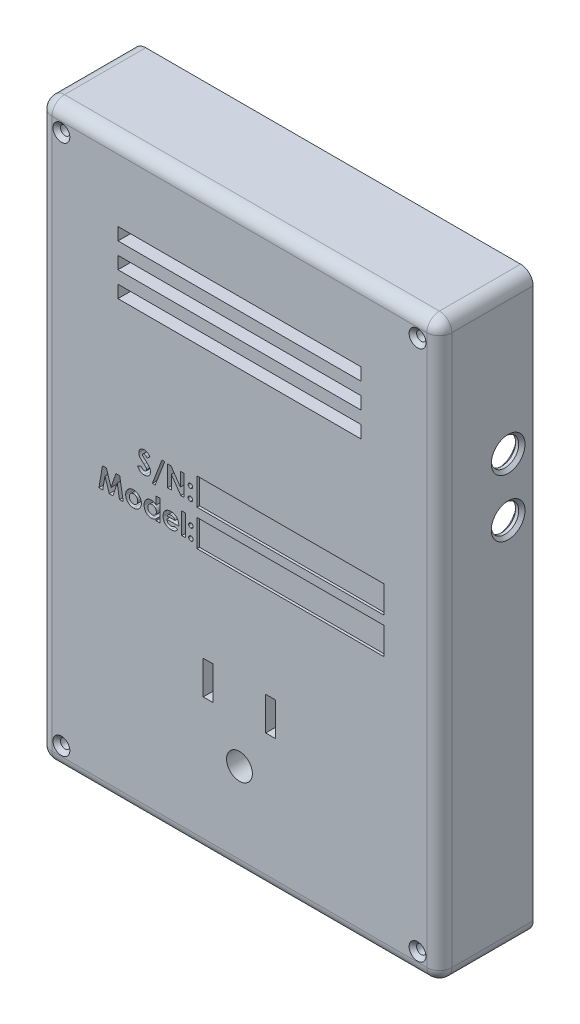
from build123d import *

# Parameters (mm, degrees)
SKETCH5_W                   = 81.28
SKETCH5_H                   = 116.84
CASE_2_DEPTH                = 12.7
CASE_CUT_DEPTH              = 7.366
SKETCH13_R                  = 2.159
BOARD_MOUNT_DEPTH           = 2.54
SKETCH11_R                  = 0.8255
BOARD_MOUNT_SCREW_CUT_DEPTH = 5.588
SKETCH8_R                   = 0.9525
FACEPLATE_SCREW_CUT_DEPTH   = 73.289667311
SKETCH14_R                  = 2.6289
SKETCH14_W                  = 2.032
SKETCH14_H                  = 6.8072
OUTLET_CUT_DEPTH            = 72.545537639
SKETCH24_W                  = 81.28
SKETCH24_H                  = 116.84
BOSS_EXTRUDE1_DEPTH         = 6.35
CUT_EXTRUDE1_START          = -6.35
CUT_EXTRUDE1_DEPTH          = 6.35
FILLET11_R                  = 2.54
FILLET12_R                  = 2.54
FILLET13_R                  = 2.54
SKETCH28_R                  = 0.9525
CUT_EXTRUDE3_DEPTH          = 73.289667311
FILLET14_R                  = 2.54
SKETCH30_W                  = 79.248
SKETCH30_H                  = 114.808
CUT_EXTRUDE4_DEPTH          = 2.032
FILLET15_R                  = 2.54
FILLET16_R                  = 2.54
FILLET17_R                  = 2.54
FILLET18_R                  = 2.54
SKETCH18_R                  = 2.794
CUT_EXTRUDE5_DEPTH          = 2.54
CHAMFER6_SIZE               = 0.635
FILLET19_R                  = 2.54
CHAMFER7_SIZE               = 0.762
SKETCH31_W                  = 38.071387925
SKETCH31_H                  = 5.512590528
SKETCH31_H_2                = 5.504700738
CUT_EXTRUDE6_DEPTH          = 0.508
SKETCH32_W                  = 0.75982906
SKETCH32_H                  = 4.341880342
CUT_EXTRUDE7_DEPTH          = 1.905
SKETCH33_W                  = 49.388401948
SKETCH33_H                  = 2.54
CUT_EXTRUDE8_DEPTH          = 27.94


with BuildPart() as part:
    # Sketch5 → Case 2 (new body)
    with BuildSketch(Plane.XY):
        Rectangle(SKETCH5_W, SKETCH5_H)
    extrude(amount=CASE_2_DEPTH)

    # Sketch4 → Case Cut (cut)
    with BuildSketch(Plane.XY):
        with BuildLine():
            Line((-36.195, 56.515), (36.195, 56.515))
            ThreePointArc((36.195, 56.515), (34.398948776, 52.178948776), (38.735, 53.975))
            Line((38.735, 53.975), (38.735, -53.975))
            ThreePointArc((38.735, -53.975), (34.398948776, -52.178948776), (36.195, -56.515))
            Line((36.195, -56.515), (-36.195, -56.515))
            ThreePointArc((-36.195, -56.515), (-34.398948776, -52.178948776), (-38.735, -53.975))
            Line((-38.735, -53.975), (-38.735, 53.975))
            ThreePointArc((-38.735, 53.975), (-34.398948776, 52.178948776), (-36.195, 56.515))
        make_face()
    extrude(amount=CASE_CUT_DEPTH, mode=Mode.SUBTRACT)

    # Sketch13 → Board Mount (add)
    with BuildSketch(Plane(origin=(0, 0, 7.366), x_dir=(-1, 0, 0), z_dir=(0, 0, -1))):
        with Locations(Location((-35.56, 48.641, 0), (0, 0, 180))):
            Circle(SKETCH13_R)
        with Locations(Location((35.56, 48.641, 0), (0, 0, 180))):
            Circle(SKETCH13_R)
        with Locations(Location((-35.56, -48.641, 0), (0, 0, 180))):
            Circle(SKETCH13_R)
        with Locations(Location((35.56, -48.641, 0), (0, 0, 180))):
            Circle(SKETCH13_R)
    extrude(amount=BOARD_MOUNT_DEPTH)

    # Sketch11 → Board Mount Screw Cut (cut)
    with BuildSketch(Plane(origin=(0, 0, 7.366), x_dir=(-1, 0, 0), z_dir=(0, 0, -1))):
        with Locations((-35.56, 48.641)):
            Circle(SKETCH11_R)
        with Locations((35.56, 48.641)):
            Circle(SKETCH11_R)
        with Locations((35.56, -48.641)):
            Circle(SKETCH11_R)
        with Locations((-35.56, -48.641)):
            Circle(SKETCH11_R)
    extrude(amount=BOARD_MOUNT_SCREW_CUT_DEPTH, mode=Mode.SUBTRACT)

    # Sketch8 → FacePlate Screw Cut (cut, through all)
    with BuildSketch(Plane.XY):
        with Locations((-36.195, 53.975)):
            Circle(SKETCH8_R)
        with Locations((-36.195, -53.975)):
            Circle(SKETCH8_R)
        with Locations((36.195, 53.975)):
            Circle(SKETCH8_R)
        with Locations((36.195, -53.975)):
            Circle(SKETCH8_R)
    extrude(amount=FACEPLATE_SCREW_CUT_DEPTH, mode=Mode.SUBTRACT)

    # Sketch14 → Outlet Cut (cut, through all)
    with BuildSketch(Plane(origin=(0, 0, 7.366), x_dir=(-1, 0, 0), z_dir=(0, 0, -1))):
        with Locations((0, -39.497)):
            Circle(SKETCH14_R)
        with Locations((-6.35, -27.559)):
            Rectangle(SKETCH14_W, SKETCH14_H)
        with Locations((6.35, -27.559)):
            Rectangle(SKETCH14_W, SKETCH14_H)
    extrude(amount=-OUTLET_CUT_DEPTH, mode=Mode.SUBTRACT)

    # Sketch24 → Boss-Extrude1 (add)
    with BuildSketch(Plane.XY):
        Rectangle(SKETCH24_W, SKETCH24_H)
    extrude(amount=-BOSS_EXTRUDE1_DEPTH)

    # Sketch26 → Cut-Extrude1 (cut)
    with BuildSketch(Plane.XY.offset(CUT_EXTRUDE1_START)):
        with BuildLine():
            Line((-36.195, 56.515), (36.195, 56.515))
            ThreePointArc((36.195, 56.515), (34.398948776, 52.178948776), (38.735, 53.975))
            Line((38.735, 53.975), (38.735, -53.975))
            ThreePointArc((38.735, -53.975), (34.398948776, -52.178948776), (36.195, -56.515))
            Line((36.195, -56.515), (-36.195, -56.515))
            ThreePointArc((-36.195, -56.515), (-34.398948776, -52.178948776), (-38.735, -53.975))
            Line((-38.735, -53.975), (-38.735, 53.975))
            ThreePointArc((-38.735, 53.975), (-34.398948776, 52.178948776), (-36.195, 56.515))
        make_face()
    extrude(amount=CUT_EXTRUDE1_DEPTH, mode=Mode.SUBTRACT)

    # Fillet11
    fillet11_edges = [part.edges().sort_by_distance(p)[0] for p in [
        (40.64, -58.42, 3.175),
    ]]
    fillet(fillet11_edges, radius=FILLET11_R)

    # Fillet12
    fillet12_edges = [part.edges().sort_by_distance(p)[0] for p in [
        (40.64, 58.42, 3.175),
    ]]
    fillet(fillet12_edges, radius=FILLET12_R)

    # Fillet13
    fillet13_edges = [part.edges().sort_by_distance(p)[0] for p in [
        (-40.64, 58.42, 3.175),
    ]]
    fillet(fillet13_edges, radius=FILLET13_R)

    # Sketch28 → Cut-Extrude3 (cut, through all)
    with BuildSketch(Plane(origin=(0, 0, 0), x_dir=(-1, 0, 0), z_dir=(0, 0, -1))):
        with Locations((-36.195, 53.975)):
            Circle(SKETCH28_R)
        with Locations((-36.195, -53.975)):
            Circle(SKETCH28_R)
        with Locations((36.195, 53.975)):
            Circle(SKETCH28_R)
        with Locations((36.195, -53.975)):
            Circle(SKETCH28_R)
    extrude(amount=CUT_EXTRUDE3_DEPTH, mode=Mode.SUBTRACT)

    # Fillet14
    fillet14_edges = [part.edges().sort_by_distance(p)[0] for p in [
        (-40.64, -58.42, 3.175),
    ]]
    fillet(fillet14_edges, radius=FILLET14_R)

    # Sketch30 → Cut-Extrude4 (cut)
    with BuildSketch(Plane(origin=(0, 0, -6.35), x_dir=(-1, 0, 0), z_dir=(0, 0, -1))):
        Rectangle(SKETCH30_W, SKETCH30_H)
    extrude(amount=-CUT_EXTRUDE4_DEPTH, mode=Mode.SUBTRACT)

    # Fillet15
    fillet15_edges = [part.edges().sort_by_distance(p)[0] for p in [
        (39.624, 57.404, -5.334),
    ]]
    fillet(fillet15_edges, radius=FILLET15_R)

    # Fillet16
    fillet16_edges = [part.edges().sort_by_distance(p)[0] for p in [
        (-39.624, 57.404, -5.334),
    ]]
    fillet(fillet16_edges, radius=FILLET16_R)

    # Fillet17
    fillet17_edges = [part.edges().sort_by_distance(p)[0] for p in [
        (-39.624, -57.404, -5.334),
    ]]
    fillet(fillet17_edges, radius=FILLET17_R)

    # Fillet18
    fillet18_edges = [part.edges().sort_by_distance(p)[0] for p in [
        (39.624, -57.404, -5.334),
    ]]
    fillet(fillet18_edges, radius=FILLET18_R)

    # Sketch18 → Cut-Extrude5 (cut)
    with BuildSketch(Plane(origin=(40.64, 0, 0), x_dir=(0, 0, -1), z_dir=(1, 0, 0))):
        with Locations((1.27, 28.829)):
            Circle(SKETCH18_R)
        with Locations((1.27, 17.145)):
            Circle(SKETCH18_R)
    extrude(amount=-CUT_EXTRUDE5_DEPTH, mode=Mode.SUBTRACT)

    # Chamfer6
    # the kernel refuses this chamfer: 0.635 mm, written as the material it takes off along each edge
    with BuildSketch(Plane(origin=(38.735, 28.829, -1.27), x_dir=(0, 0, -1), z_dir=(0, -1, 0))) as chamfer6_piece_1:
        Polygon((2.794, CHAMFER6_SIZE), (2.794 + CHAMFER6_SIZE, 0), (2.794, 0), align=None)
    revolve(axis=Axis((38.735, 28.829, -1.27), (1, 0, 0)), mode=Mode.SUBTRACT)
    with BuildSketch(Plane(origin=(40.64, 28.829, -1.27), x_dir=(0, 0, -1), z_dir=(0, -1, 0))) as chamfer6_piece_2:
        Polygon((2.794 + CHAMFER6_SIZE, 0), (2.794, -CHAMFER6_SIZE), (2.794, 0), align=None)
    revolve(axis=Axis((40.64, 28.829, -1.27), (1, 0, 0)), mode=Mode.SUBTRACT)
    with BuildSketch(Plane(origin=(38.735, 17.145, -1.27), x_dir=(0, 0, -1), z_dir=(0, -1, 0))) as chamfer6_piece_3:
        Polygon((2.794, CHAMFER6_SIZE), (2.794 + CHAMFER6_SIZE, 0), (2.794, 0), align=None)
    revolve(axis=Axis((38.735, 17.145, -1.27), (1, 0, 0)), mode=Mode.SUBTRACT)
    with BuildSketch(Plane(origin=(40.64, 17.145, -1.27), x_dir=(0, 0, -1), z_dir=(0, -1, 0))) as chamfer6_piece_4:
        Polygon((2.794 + CHAMFER6_SIZE, 0), (2.794, -CHAMFER6_SIZE), (2.794, 0), align=None)
    revolve(axis=Axis((40.64, 17.145, -1.27), (1, 0, 0)), mode=Mode.SUBTRACT)

    # Fillet19
    fillet19_edges = [part.edges().sort_by_distance(p)[0] for p in [
        (40.64, 0, 12.7),
        (39.896051224, -57.676051224, 12.7),
        (0, 58.42, 12.7),
        (39.896051224, 57.676051224, 12.7),
        (-40.64, 0, 12.7),
        (-39.896051224, 57.676051224, 12.7),
        (0, -58.42, 12.7),
        (-39.896051224, -57.676051224, 12.7),
    ]]
    fillet(fillet19_edges, radius=FILLET19_R)

    # Chamfer7
    chamfer7_edges = [part.edges().sort_by_distance(p)[0] for p in [
        (-37.1475, 53.975, 12.7),
        (-37.1475, -53.975, 12.7),
        (35.2425, 53.975, 12.7),
        (35.2425, -53.975, 12.7),
    ]]
    chamfer(chamfer7_edges, length=CHAMFER7_SIZE)

    # Sketch31 → Cut-Extrude6 (cut)
    with BuildSketch(Plane.XY.offset(12.7)):
        with Locations((10.393000027, 4.552836284)):
            Rectangle(SKETCH31_W, SKETCH31_H)
        with Locations((10.393000027, -2.752350369)):
            Rectangle(SKETCH31_W, SKETCH31_H_2)
    extrude(amount=-CUT_EXTRUDE6_DEPTH, mode=Mode.SUBTRACT)

    # Sketch32 → Cut-Extrude7 (cut)
    # profile 1 of 12: a face of its own
    with BuildSketch(Plane.XY.offset(12.7)):
        with BuildLine():
            Line((-18.191123097, 5.877144928), (-18.759298845, 5.35730652))
            add(Edge.make_bspline(
                [(-18.759298845, 5.35730652), (-18.783637058, 5.3916381), (-18.830363032, 5.457549944), (-18.906100963, 5.545807458), (-18.981496898, 5.621097685), (-19.057249335, 5.683106097), (-19.134029715, 5.731455949), (-19.211704758, 5.765688177), (-19.289834103, 5.78744993), (-19.342324962, 5.790159792), (-19.368179721, 5.791494554)],
                knots=[0, 0, 0, 0, 1.299362458, 2.494594718, 3.587462134, 4.587049575, 5.512617175, 6.380583204, 7.202344345, 8, 8, 8, 8], degree=3))
            add(Edge.make_bspline(
                [(-19.368179721, 5.791494554), (-19.392296298, 5.790648788), (-19.438859073, 5.789015835), (-19.505237763, 5.772784401), (-19.564169709, 5.744771331), (-19.615597397, 5.708141885), (-19.656335713, 5.664011895), (-19.688862099, 5.617730882), (-19.707177188, 5.56664711), (-19.709587814, 5.531560715), (-19.710781217, 5.514190869)],
                knots=[0, 0, 0, 0, 1.185010067, 2.2879431, 3.333075148, 4.379039566, 5.372662701, 6.27520591, 7.14612461, 8, 8, 8, 8], degree=3))
            add(Edge.make_bspline(
                [(-19.710781217, 5.514190869), (-19.710033372, 5.496570541), (-19.708527316, 5.461085649), (-19.693980864, 5.409078121), (-19.672055208, 5.358260713), (-19.651104348, 5.327325738), (-19.640395266, 5.311513251)],
                knots=[0, 0, 0, 0, 0.967525499, 1.948461899, 2.951351359, 4, 4, 4, 4], degree=3))
            add(Edge.make_bspline(
                [(-19.640395266, 5.311513251), (-19.630659552, 5.29922237), (-19.608249223, 5.270930386), (-19.565517316, 5.226120294), (-19.511855016, 5.171224009), (-19.445197284, 5.108129253), (-19.368311265, 5.034566892), (-19.277633194, 4.95342869), (-19.175773181, 4.862201892), (-19.103373444, 4.798674854), (-19.06543533, 4.765386114)],
                knots=[0, 0, 0, 0, 0.473873513, 1.090794244, 1.870441696, 2.795289791, 3.865433203, 5.087734844, 6.473946851, 8, 8, 8, 8], degree=3))
            add(Edge.make_bspline(
                [(-19.06543533, 4.765386114), (-19.029824953, 4.734567129), (-18.962243855, 4.676079098), (-18.866089373, 4.593064728), (-18.781585599, 4.518378724), (-18.707501503, 4.453141963), (-18.64496013, 4.396669961), (-18.593698554, 4.348692783), (-18.553090703, 4.310144456), (-18.530007518, 4.286861243), (-18.520156217, 4.276924576)],
                knots=[0, 0, 0, 0, 1.543621617, 2.929473131, 4.163658386, 5.240097082, 6.164993805, 6.925417477, 7.541396219, 8, 8, 8, 8], degree=3))
            add(Edge.make_bspline(
                [(-18.520156217, 4.276924576), (-18.482782434, 4.236478138), (-18.410936897, 4.158725881), (-18.317563027, 4.038234335), (-18.240713312, 3.920610017), (-18.181260915, 3.803639635), (-18.136360074, 3.685635539), (-18.104704386, 3.563703686), (-18.085745583, 3.436569964), (-18.083640714, 3.349816718), (-18.082576089, 3.305937663)],
                knots=[0, 0, 0, 0, 1.206664779, 2.319633467, 3.337109185, 4.282041471, 5.190008762, 6.099243693, 7.03861361, 8, 8, 8, 8], degree=3))
            add(Edge.make_bspline(
                [(-18.082576089, 3.305937663), (-18.083333861, 3.263182906), (-18.08482064, 3.179296481), (-18.103030829, 3.056541193), (-18.128997489, 2.939059055), (-18.1691465, 2.828128438), (-18.218079878, 2.721928451), (-18.279424934, 2.622113351), (-18.351466291, 2.527672968), (-18.434036748, 2.440295541), (-18.525369477, 2.361006582), (-18.62333251, 2.290421678), (-18.728883778, 2.232144849), (-18.841121467, 2.184158037), (-18.959985499, 2.147197952), (-19.085334271, 2.119881006), (-19.217359513, 2.103485805), (-19.307640277, 2.101771881), (-19.353763321, 2.100896264)],
                knots=[0, 0, 0, 0, 1.043214005, 2.046824704, 3.02475056, 3.976699089, 4.921714032, 5.875962561, 6.831408892, 7.817874052, 8.806269674, 9.781291748, 10.760897367, 11.74438705, 12.757449933, 13.795994037, 14.874007457, 16, 16, 16, 16], degree=3))
            add(Edge.make_bspline(
                [(-19.353763321, 2.100896264), (-19.389969519, 2.101538586), (-19.461678554, 2.102810752), (-19.567366831, 2.113196929), (-19.66942081, 2.129959113), (-19.767725536, 2.153984331), (-19.862723889, 2.184427541), (-19.954419771, 2.221612755), (-20.042180175, 2.266116331), (-20.126669137, 2.317023097), (-20.207475937, 2.376132559), (-20.285622345, 2.442236243), (-20.360332136, 2.516350852), (-20.431964128, 2.598301108), (-20.500059997, 2.688319076), (-20.566848767, 2.785151087), (-20.629362144, 2.890594214), (-20.667979437, 2.96456342), (-20.687704294, 3.002345249)],
                knots=[0, 0, 0, 0, 1.016823716, 2.013894106, 2.979844003, 3.91962641, 4.853723003, 5.779685073, 6.695824784, 7.614987388, 8.547259901, 9.504950863, 10.487499108, 11.500346958, 12.559593716, 13.656357062, 14.802919212, 16, 16, 16, 16], degree=3))
            Line((-20.687704294, 3.002345249), (-20.019461772, 3.403460366))
            add(Edge.make_bspline(
                [(-20.019461772, 3.403460366), (-19.994788925, 3.360573054), (-19.947488968, 3.278354412), (-19.86733477, 3.167883246), (-19.785220886, 3.073282978), (-19.699248916, 2.996225674), (-19.610464248, 2.93568098), (-19.518438031, 2.892411542), (-19.423105609, 2.865627808), (-19.358169495, 2.862356896), (-19.325778546, 2.860725324)],
                knots=[0, 0, 0, 0, 1.283663364, 2.460892379, 3.537111102, 4.529833553, 5.449777664, 6.316464042, 7.160231139, 8, 8, 8, 8], degree=3))
            add(Edge.make_bspline(
                [(-19.325778546, 2.860725324), (-19.292832314, 2.862057754), (-19.228911825, 2.864642863), (-19.137673506, 2.888520734), (-19.054022761, 2.926010744), (-18.981715675, 2.979503818), (-18.920490593, 3.041242955), (-18.875302969, 3.109930569), (-18.846915798, 3.184248909), (-18.843914586, 3.235875316), (-18.842405148, 3.261840441)],
                knots=[0, 0, 0, 0, 1.13588714, 2.203786484, 3.234766741, 4.283437687, 5.291419208, 6.222934724, 7.106237994, 8, 8, 8, 8], degree=3))
            add(Edge.make_bspline(
                [(-18.842405148, 3.261840441), (-18.843799052, 3.285996764), (-18.846630635, 3.335068022), (-18.867487199, 3.408029092), (-18.90009237, 3.480956981), (-18.938666586, 3.540774409), (-18.977920682, 3.590857919), (-19.015456451, 3.634253015), (-19.061165088, 3.682197), (-19.114930696, 3.734750182), (-19.176042892, 3.792375201), (-19.244553154, 3.855066414), (-19.321245998, 3.922271587), (-19.375452651, 3.968051086), (-19.403796708, 3.991988678)],
                knots=[0, 0, 0, 0, 0.916159276, 1.861089862, 2.860218735, 3.940849679, 4.552606315, 5.27541173, 6.11797699, 7.06649574, 8.129236253, 9.306560635, 10.591630461, 12, 12, 12, 12], degree=3))
            add(Edge.make_bspline(
                [(-19.403796708, 3.991988678), (-19.457679889, 4.037579016), (-19.561098022, 4.125080674), (-19.707240965, 4.254317867), (-19.838928842, 4.375101866), (-19.955024255, 4.488925826), (-20.057006439, 4.59368768), (-20.144184727, 4.690238346), (-20.215601426, 4.779322579), (-20.290752102, 4.884836891), (-20.362160269, 5.013413331), (-20.42387719, 5.168105694), (-20.463916523, 5.322778428), (-20.468402374, 5.426617183), (-20.470610277, 5.477725858)],
                knots=[0, 0, 0, 0, 1.345494975, 2.582412109, 3.71882943, 4.751509156, 5.681369928, 6.505683931, 7.230279997, 7.856715994, 8.973648664, 10.023341002, 11.027102913, 12, 12, 12, 12], degree=3))
            add(Edge.make_bspline(
                [(-20.470610277, 5.477725858), (-20.469692013, 5.513969387), (-20.467882934, 5.585373032), (-20.451745677, 5.690361689), (-20.42762793, 5.791666921), (-20.392602038, 5.888919121), (-20.347142659, 5.981996477), (-20.29193401, 6.071354641), (-20.226118803, 6.156171181), (-20.151949509, 6.236389869), (-20.070233936, 6.309700622), (-19.982910462, 6.374404707), (-19.890473345, 6.429054718), (-19.793488069, 6.47439087), (-19.691353656, 6.509092815), (-19.584822526, 6.533691283), (-19.47374188, 6.548321668), (-19.398187222, 6.550310499), (-19.359699486, 6.551323614)],
                knots=[0, 0, 0, 0, 1.010766082, 1.991317756, 2.957454644, 3.913069143, 4.869106762, 5.843196583, 6.838735724, 7.860187025, 8.887984031, 9.89767229, 10.887916223, 11.879572884, 12.879850636, 13.892031539, 14.926195476, 16, 16, 16, 16], degree=3))
            add(Edge.make_bspline(
                [(-19.359699486, 6.551323614), (-19.309821285, 6.549498963), (-19.210458604, 6.545864065), (-19.063548015, 6.517440346), (-18.920051894, 6.472741054), (-18.80442003, 6.418816276), (-18.712413914, 6.366579318), (-18.641899821, 6.318486107), (-18.570147936, 6.263392749), (-18.496579624, 6.201125631), (-18.422561899, 6.130511557), (-18.345990082, 6.053231552), (-18.267907559, 5.968617736), (-18.217166299, 5.908170018), (-18.191123097, 5.877144928)],
                knots=[0, 0, 0, 0, 1.282922637, 2.555718331, 3.837320111, 5.142675274, 5.830281639, 6.55870424, 7.337177975, 8.157850921, 9.037902056, 9.96903443, 10.957596896, 12, 12, 12, 12], degree=3))
        make_face()
    # profile 2 of 12: a face of its own
    with BuildSketch(Plane.XY.offset(12.7)):
        Polygon((-17.702661559, 1.449614213), (-15.754751569, 6.551323614), (-15.17894361, 6.551323614), (-17.126853599, 1.449614213), align=None)
    # profile 3 of 12: a face of its own
    with BuildSketch(Plane.XY.offset(12.7)):
        Polygon((-14.609071815, 6.442776606), (-13.924716847, 6.442776606), (-12.00394361, 3.657019394), (-12.00394361, 6.442776606), (-11.24411455, 6.442776606), (-11.24411455, 2.209443272), (-11.933557659, 2.209443272), (-13.849242755, 4.986720249), (-13.849242755, 2.209443272), (-14.609071815, 2.209443272), align=None)
    # profile 4 of 12: a face of its own
    with BuildSketch(Plane.XY.offset(12.7)):
        with BuildLine():
            add(Edge.make_bspline(
                [(-9.9686872, 5.35730652), (-9.937984768, 5.355718732), (-9.87745762, 5.352588546), (-9.790545469, 5.326478209), (-9.711335748, 5.282486162), (-9.641172065, 5.223512547), (-9.581903266, 5.153199943), (-9.538407615, 5.073439373), (-9.511958455, 4.986110206), (-9.508913781, 4.925280522), (-9.507362413, 4.894285687)],
                knots=[0, 0, 0, 0, 1.013817282, 1.998651736, 2.969187861, 3.991244904, 5.013301947, 5.9920405, 6.976874954, 8, 8, 8, 8], degree=3))
            add(Edge.make_bspline(
                [(-9.507362413, 4.894285687), (-9.508893514, 4.863843269), (-9.511898432, 4.804097377), (-9.538799386, 4.718083569), (-9.581866264, 4.638752833), (-9.641182178, 4.568453843), (-9.711333192, 4.509476568), (-9.790546146, 4.465485454), (-9.877457444, 4.439374871), (-9.937984709, 4.436244719), (-9.9686872, 4.434656948)],
                knots=[0, 0, 0, 0, 1.009116963, 1.980479832, 2.963706907, 3.990451133, 5.017195359, 5.992182391, 6.981533323, 8, 8, 8, 8], degree=3))
            add(Edge.make_bspline(
                [(-9.9686872, 4.434656948), (-9.99940554, 4.436214655), (-10.059964051, 4.43928554), (-10.146757405, 4.465862547), (-10.226762822, 4.508213247), (-10.296884149, 4.566824871), (-10.356742443, 4.636055979), (-10.398546924, 4.716040624), (-10.425601169, 4.802663802), (-10.428518728, 4.863267593), (-10.430011986, 4.894285687)],
                knots=[0, 0, 0, 0, 1.016706445, 2.004347467, 2.981433789, 4.000427929, 5.018214116, 5.995300439, 6.973959266, 8, 8, 8, 8], degree=3))
            add(Edge.make_bspline(
                [(-10.430011986, 4.894285687), (-10.428481289, 4.92529182), (-10.425477182, 4.986143677), (-10.398772747, 5.073182383), (-10.35649654, 5.15345188), (-10.296961165, 5.223440376), (-10.226780242, 5.282779937), (-10.146985625, 5.326258075), (-10.059938403, 5.352626918), (-9.999396909, 5.355731645), (-9.9686872, 5.35730652)],
                knots=[0, 0, 0, 0, 1.022642663, 2.007012786, 2.980863166, 4.002438329, 5.024013493, 6.00229059, 6.986660713, 8, 8, 8, 8], degree=3))
        make_face()
    # profile 5 of 12: a face of its own
    with BuildSketch(Plane.XY.offset(12.7)):
        with BuildLine():
            add(Edge.make_bspline(
                [(-9.9686872, 3.077819341), (-9.938013801, 3.076137592), (-9.877623178, 3.072826519), (-9.790366961, 3.048116329), (-9.711617723, 3.003720953), (-9.641205382, 2.945814879), (-9.581666479, 2.87614614), (-9.538633107, 2.796697462), (-9.511835147, 2.709777455), (-9.508876633, 2.649196835), (-9.507362413, 2.618190601)],
                knots=[0, 0, 0, 0, 1.016957001, 2.002212695, 2.9757545, 3.99499976, 5.013036768, 5.994806404, 6.97370641, 8, 8, 8, 8], degree=3))
            add(Edge.make_bspline(
                [(-9.507362413, 2.618190601), (-9.508866713, 2.587179388), (-9.511805846, 2.526589038), (-9.538818546, 2.439499662), (-9.581602174, 2.359397988), (-9.641210159, 2.288982703), (-9.711326121, 2.229985335), (-9.790548019, 2.185999349), (-9.877456956, 2.159887412), (-9.937984545, 2.156757446), (-9.9686872, 2.155169768)],
                knots=[0, 0, 0, 0, 1.023218912, 1.999186227, 2.986238111, 4.008388923, 5.030539734, 6.0011649, 6.986089706, 8, 8, 8, 8], degree=3))
            add(Edge.make_bspline(
                [(-9.9686872, 2.155169768), (-9.99939713, 2.156744535), (-10.05993906, 2.15984905), (-10.146983091, 2.186219446), (-10.226789867, 2.229691667), (-10.296923446, 2.289054267), (-10.356797733, 2.359148641), (-10.398364982, 2.439752397), (-10.425629298, 2.526556205), (-10.428528251, 2.587168272), (-10.430011986, 2.618190601)],
                knots=[0, 0, 0, 0, 1.013427518, 1.99788335, 2.976245624, 3.997909735, 5.019573847, 6.001765691, 6.977268297, 8, 8, 8, 8], degree=3))
            add(Edge.make_bspline(
                [(-10.430011986, 2.618190601), (-10.428518462, 2.649208145), (-10.425600384, 2.70981086), (-10.398549893, 2.796441816), (-10.356731114, 2.876396841), (-10.296928439, 2.945743166), (-10.226496763, 3.004012328), (-10.147165165, 3.047899247), (-10.059772922, 3.072865165), (-9.999367907, 3.076150609), (-9.9686872, 3.077819341)],
                knots=[0, 0, 0, 0, 1.025808215, 2.00424526, 2.981110158, 3.998665696, 5.017428914, 5.998734231, 6.983523959, 8, 8, 8, 8], degree=3))
        make_face()
    # profile 6 of 12: a face of its own
    with BuildSketch(Plane.XY.offset(12.7)):
        Polygon((-27.846040786, -0.50739833), (-27.057378927, -0.50739833), (-26.091480156, -3.460216172), (-25.118797197, -0.50739833), (-24.337767549, -0.50739833), (-23.622035711, -4.740731663), (-24.39119303, -4.740731663), (-24.843189558, -2.066913554), (-25.723437955, -4.740731663), (-26.464610498, -4.740731663), (-27.339770754, -2.066913554), (-27.790919258, -4.740731663), (-28.5609246, -4.740731663), align=None)
    # profile 7 of 12: a face of its own
    with BuildSketch(Plane.XY.offset(12.7)):
        with BuildLine():
            add(Edge.make_bspline(
                [(-21.551162314, -1.592868415), (-21.515239063, -1.593507694), (-21.444094748, -1.594773756), (-21.338134179, -1.605312564), (-21.234026045, -1.622507064), (-21.131171946, -1.64477094), (-21.030526979, -1.67596596), (-20.931563274, -1.713379563), (-20.833395968, -1.756334754), (-20.738461555, -1.807466457), (-20.646074204, -1.862923452), (-20.558485498, -1.924097067), (-20.476422799, -1.990506806), (-20.398362745, -2.060612905), (-20.32794306, -2.137467555), (-20.260663549, -2.217367578), (-20.200159159, -2.303175512), (-20.14414081, -2.392800416), (-20.094268076, -2.485724008), (-20.050962779, -2.581299876), (-20.013377853, -2.678206618), (-19.983949609, -2.777624624), (-19.959585736, -2.878242935), (-19.9442104, -2.981294553), (-19.933279602, -3.085720881), (-19.932053913, -3.156029277), (-19.931437421, -3.191392721)],
                knots=[0, 0, 0, 0, 1.022364134, 2.024744242, 3.027414945, 4.024939316, 5.017584196, 6.023349371, 7.035562955, 8.064994934, 9.090267829, 10.101425541, 11.102933353, 12.093946398, 13.084502048, 14.067315274, 15.065326281, 16.070028806, 17.074376865, 18.064572984, 19.055292013, 20.030201733, 21.013838017, 21.999348303, 22.993720005, 24, 24, 24, 24], degree=3))
            add(Edge.make_bspline(
                [(-19.931437421, -3.191392721), (-19.932088026, -3.227032441), (-19.933381577, -3.297892285), (-19.943814937, -3.40330087), (-19.961075252, -3.506837093), (-19.983424577, -3.609110901), (-20.014502857, -3.708813605), (-20.050814509, -3.80741486), (-20.095388491, -3.903570696), (-20.144668312, -3.998330081), (-20.201046836, -4.088904537), (-20.261498852, -4.175572059), (-20.328496564, -4.256058952), (-20.39835252, -4.332861338), (-20.474380145, -4.403382103), (-20.555365899, -4.468766318), (-20.640608667, -4.529813333), (-20.730721437, -4.585090871), (-20.824550014, -4.633661272), (-20.920511996, -4.677451452), (-21.019168516, -4.713909903), (-21.120315399, -4.743640767), (-21.224013986, -4.76666063), (-21.33003534, -4.782298297), (-21.438151127, -4.793174114), (-21.510995288, -4.794390887), (-21.54777022, -4.795005167)],
                knots=[0, 0, 0, 0, 1.012026251, 2.012137606, 3.004615893, 3.992048833, 4.982446996, 5.968083444, 6.973977695, 7.990229942, 8.999482246, 10.001782172, 10.988562221, 11.971415814, 12.948383116, 13.930088534, 14.925840678, 15.924049238, 16.929462851, 17.924729459, 18.917889337, 19.913673841, 20.916777188, 21.931792057, 22.95587778, 24, 24, 24, 24], degree=3))
            add(Edge.make_bspline(
                [(-21.54777022, -4.795005167), (-21.60154267, -4.79342684), (-21.707528987, -4.790315933), (-21.863621774, -4.769007031), (-22.013575415, -4.732328824), (-22.157634258, -4.681200213), (-22.295985439, -4.615680802), (-22.427421539, -4.534590582), (-22.553249989, -4.439525987), (-22.671291347, -4.331290511), (-22.779433221, -4.212546392), (-22.873908159, -4.085787768), (-22.954125027, -3.952914539), (-23.020011653, -3.813775184), (-23.070862693, -3.668178905), (-23.107585821, -3.516560985), (-23.128920775, -3.358495247), (-23.132005371, -3.251100824), (-23.133574173, -3.196480862)],
                knots=[0, 0, 0, 0, 1.029999031, 2.030143771, 3.011211297, 3.982305373, 4.953580601, 5.938004764, 6.935448627, 7.970290061, 9.001484052, 10.007591832, 10.993831261, 11.969999897, 12.951306496, 13.942897864, 14.953773953, 16, 16, 16, 16], degree=3))
            add(Edge.make_bspline(
                [(-23.133574173, -3.196480862), (-23.131950663, -3.138158715), (-23.128759685, -3.023527704), (-23.103421921, -2.855590659), (-23.062960246, -2.694798898), (-23.00488006, -2.541602206), (-22.93068773, -2.395718032), (-22.840115709, -2.257454062), (-22.732716386, -2.126778977), (-22.65047001, -2.047742206), (-22.608647624, -2.007551909)],
                knots=[0, 0, 0, 0, 1.043912699, 2.05178951, 3.033892, 4.007821512, 4.978932272, 5.95884105, 6.962068106, 8, 8, 8, 8], degree=3))
            add(Edge.make_bspline(
                [(-22.608647624, -2.007551909), (-22.570271405, -1.974238673), (-22.494563068, -1.908518555), (-22.371561939, -1.825163359), (-22.245622662, -1.753169901), (-22.115235801, -1.693977887), (-21.980037872, -1.649348064), (-21.840721686, -1.616861546), (-21.697316213, -1.596907375), (-21.600127859, -1.594221577), (-21.551162314, -1.592868415)],
                knots=[0, 0, 0, 0, 1.048115528, 2.067714963, 3.060638214, 4.039924844, 5.017819947, 5.994373833, 6.98952318, 8, 8, 8, 8], degree=3))
        make_face()
        with BuildLine():
            add(Edge.make_bspline(
                [(-21.534201844, -2.298423971), (-21.56362034, -2.299401744), (-21.621530966, -2.301326502), (-21.706776929, -2.311656161), (-21.787403459, -2.332827684), (-21.865011949, -2.359752067), (-21.938229496, -2.395759635), (-22.009061269, -2.437896789), (-22.073824171, -2.490626251), (-22.135652287, -2.548466613), (-22.191778434, -2.612696784), (-22.239603241, -2.682675506), (-22.282335766, -2.755725542), (-22.314737673, -2.834521343), (-22.341553348, -2.916909192), (-22.359701875, -3.004220226), (-22.372331983, -3.095479133), (-22.373269589, -3.157992109), (-22.373745113, -3.189696674)],
                knots=[0, 0, 0, 0, 1.030650113, 2.02884584, 2.99876339, 3.944280128, 4.900564847, 5.851248946, 6.823638398, 7.81794922, 8.81432732, 9.802856497, 10.78262424, 11.771747962, 12.779760563, 13.812642396, 14.89064281, 16, 16, 16, 16], degree=3))
            add(Edge.make_bspline(
                [(-22.373745113, -3.189696674), (-22.373188686, -3.222519301), (-22.372101255, -3.286664822), (-22.360840683, -3.380325909), (-22.342271628, -3.46920966), (-22.31589082, -3.553178768), (-22.2827125, -3.632835954), (-22.242006549, -3.707734287), (-22.193343361, -3.777423431), (-22.138171117, -3.841817571), (-22.077759866, -3.900268844), (-22.011565941, -3.95042954), (-21.942361292, -3.994012527), (-21.868551071, -4.029016392), (-21.791183592, -4.056042216), (-21.710029185, -4.075940422), (-21.624661383, -4.08666061), (-21.566454033, -4.088507161), (-21.536745914, -4.089449612)],
                knots=[0, 0, 0, 0, 1.141730614, 2.231293227, 3.276944405, 4.297399982, 5.28939179, 6.275415646, 7.257752684, 8.24146775, 9.222424823, 10.176631434, 11.126518621, 12.063689483, 13.012557477, 13.974037417, 14.965980454, 16, 16, 16, 16], degree=3))
            add(Edge.make_bspline(
                [(-21.536745914, -4.089449612), (-21.507022937, -4.088613701), (-21.448748647, -4.086974829), (-21.363280596, -4.074702272), (-21.281711755, -4.055387685), (-21.203683498, -4.028129259), (-21.12982669, -3.992376154), (-21.059858602, -3.948584661), (-20.993163715, -3.897726275), (-20.93194174, -3.838172137), (-20.875269728, -3.773577175), (-20.825571763, -3.703520146), (-20.784042269, -3.628621795), (-20.749980648, -3.549353381), (-20.723548125, -3.465823859), (-20.705286485, -3.377722761), (-20.692649624, -3.285323118), (-20.691733222, -3.221965818), (-20.691266481, -3.189696674)],
                knots=[0, 0, 0, 0, 1.031504075, 2.022346795, 2.991027682, 3.937587355, 4.885570121, 5.833146507, 6.798790848, 7.791235734, 8.792807298, 9.778388351, 10.766749885, 11.760164525, 12.768777521, 13.802286646, 14.880660483, 16, 16, 16, 16], degree=3))
            add(Edge.make_bspline(
                [(-20.691266481, -3.189696674), (-20.691829987, -3.157438808), (-20.692935768, -3.09413841), (-20.704197143, -3.001613798), (-20.722583966, -2.913797467), (-20.749305028, -2.831064386), (-20.782286141, -2.752470701), (-20.823020228, -2.678418705), (-20.871923407, -2.609273122), (-20.927363859, -2.545376815), (-20.988680712, -2.487745746), (-21.053725352, -2.436352822), (-21.123985149, -2.393846926), (-21.198141987, -2.358806895), (-21.276393162, -2.331848592), (-21.358650825, -2.311837619), (-21.44516707, -2.301269974), (-21.504213412, -2.299382553), (-21.534201844, -2.298423971)],
                knots=[0, 0, 0, 0, 1.123894411, 2.205445421, 3.243160173, 4.246488011, 5.231014757, 6.210004299, 7.185865357, 8.177612767, 9.153374344, 10.115157457, 11.061423229, 12.009021698, 12.96873347, 13.94135618, 14.954456845, 16, 16, 16, 16], degree=3))
        make_face(mode=Mode.SUBTRACT)
    # profile 8 of 12: a face of its own
    with BuildSketch(Plane.XY.offset(12.7)):
        with BuildLine():
            Line((-16.946394686, -0.398851321), (-16.186565626, -0.398851321))
            Line((-16.186565626, -0.398851321), (-16.186565626, -4.740731663))
            Line((-16.186565626, -4.740731663), (-16.946394686, -4.740731663))
            Line((-16.946394686, -4.740731663), (-16.946394686, -4.403218308))
            add(Edge.make_bspline(
                [(-16.946394686, -4.403218308), (-16.984043936, -4.436071498), (-17.057113695, -4.499833051), (-17.172247992, -4.582565288), (-17.287718724, -4.65080869), (-17.404080732, -4.705160839), (-17.523122451, -4.745294306), (-17.645700933, -4.774351874), (-17.77358144, -4.791487833), (-17.860512847, -4.79382051), (-17.904661246, -4.795005167)],
                knots=[0, 0, 0, 0, 1.129196829, 2.191548051, 3.199897424, 4.157751732, 5.089409408, 6.034969131, 7.002052659, 8, 8, 8, 8], degree=3))
            add(Edge.make_bspline(
                [(-17.904661246, -4.795005167), (-17.954219786, -4.793890255), (-18.05215027, -4.791687126), (-18.195852383, -4.768495632), (-18.334611059, -4.732995882), (-18.468313666, -4.682759299), (-18.596716943, -4.617662535), (-18.720803565, -4.539404057), (-18.838446309, -4.445236524), (-18.95062451, -4.339234325), (-19.053334198, -4.222631151), (-19.143123977, -4.09704544), (-19.218810088, -3.964258346), (-19.280815668, -3.824710121), (-19.329591064, -3.678503184), (-19.364360942, -3.525173813), (-19.38487521, -3.364667245), (-19.387414299, -3.255336456), (-19.388702378, -3.199872956)],
                knots=[0, 0, 0, 0, 0.980476535, 1.937477201, 2.874147792, 3.812856188, 4.758993464, 5.720109578, 6.712210464, 7.737600662, 8.772720504, 9.783789959, 10.789002326, 11.793715968, 12.802552247, 13.835794126, 14.902098527, 16, 16, 16, 16], degree=3))
            add(Edge.make_bspline(
                [(-19.388702378, -3.199872956), (-19.387350534, -3.142440428), (-19.384698741, -3.029780126), (-19.365301036, -2.864456489), (-19.331172793, -2.707325328), (-19.28463648, -2.558168995), (-19.224775595, -2.41696172), (-19.151869036, -2.28347216), (-19.064924978, -2.158049238), (-18.964737365, -2.042827737), (-18.85655935, -1.937221667), (-18.740827998, -1.845283208), (-18.619353094, -1.767177209), (-18.492005551, -1.703412403), (-18.358803553, -1.654138188), (-18.220272981, -1.618114714), (-18.075798855, -1.596499364), (-17.97738191, -1.594088783), (-17.92755788, -1.592868415)],
                knots=[0, 0, 0, 0, 1.136281865, 2.228943489, 3.287578264, 4.313574083, 5.316051562, 6.317280042, 7.318008486, 8.329309503, 9.333984563, 10.305318864, 11.248632312, 12.186624717, 13.117503092, 14.05354244, 15.014596925, 16, 16, 16, 16], degree=3))
            add(Edge.make_bspline(
                [(-17.92755788, -1.592868415), (-17.881434439, -1.594331766), (-17.790225331, -1.597225542), (-17.655493768, -1.615441139), (-17.525856416, -1.64973952), (-17.399738834, -1.693930462), (-17.278778901, -1.753396397), (-17.162326753, -1.824829221), (-17.050075558, -1.909136112), (-16.98139189, -1.974331918), (-16.946394686, -2.007551909)],
                knots=[0, 0, 0, 0, 1.011899165, 2.001030639, 2.974036179, 3.948778736, 4.92769327, 5.924124564, 6.942254589, 8, 8, 8, 8], degree=3))
            Line((-16.946394686, -2.007551909), (-16.946394686, -0.398851321))
        make_face()
        with BuildLine():
            add(Edge.make_bspline(
                [(-17.768129461, -2.298423971), (-17.79840641, -2.299352972), (-17.857747251, -2.301173754), (-17.94501608, -2.312125884), (-18.0284189, -2.331424025), (-18.10736089, -2.359932884), (-18.183018575, -2.394660828), (-18.254243082, -2.438157006), (-18.321622248, -2.489568564), (-18.384759809, -2.54765083), (-18.442318998, -2.611493859), (-18.491938379, -2.681160437), (-18.534106836, -2.754773444), (-18.569770391, -2.83255421), (-18.595297405, -2.915423121), (-18.61551479, -3.002301372), (-18.626006304, -3.093898714), (-18.627908085, -3.156319468), (-18.628873318, -3.188000627)],
                knots=[0, 0, 0, 0, 1.04836806, 2.054732945, 3.03993516, 4.00574415, 4.955904794, 5.917688631, 6.888591924, 7.88601754, 8.884115178, 9.859153345, 10.841239365, 11.818093293, 12.814750328, 13.83810466, 14.90274714, 16, 16, 16, 16], degree=3))
            add(Edge.make_bspline(
                [(-18.628873318, -3.188000627), (-18.627922829, -3.219969152), (-18.6260499, -3.282962761), (-18.615345152, -3.37533276), (-18.595855273, -3.463480098), (-18.567420273, -3.546692165), (-18.532694543, -3.626091768), (-18.49042552, -3.701312468), (-18.438505428, -3.771024271), (-18.380895782, -3.836876791), (-18.316462964, -3.895680536), (-18.24870254, -3.947892862), (-18.176688955, -3.991578882), (-18.101203507, -4.0268862), (-18.022500282, -4.055658696), (-17.939592581, -4.074714299), (-17.853292589, -4.086896185), (-17.794459606, -4.088592592), (-17.764737367, -4.089449612)],
                knots=[0, 0, 0, 0, 1.099136573, 2.165835871, 3.191374663, 4.196217796, 5.183857741, 6.167377911, 7.154730987, 8.166690795, 9.170734848, 10.148332609, 11.103258353, 12.059567475, 13.009337315, 13.978056681, 14.978520572, 16, 16, 16, 16], degree=3))
            add(Edge.make_bspline(
                [(-17.764737367, -4.089449612), (-17.733896476, -4.088515402), (-17.673431562, -4.086683844), (-17.584738987, -4.075831664), (-17.500215768, -4.056462765), (-17.420213566, -4.027790686), (-17.343510425, -3.99331202), (-17.27079852, -3.95066579), (-17.202866887, -3.899372207), (-17.139371482, -3.840764877), (-17.081190184, -3.776400531), (-17.030884606, -3.705820387), (-16.987066608, -3.631281792), (-16.952605768, -3.551022381), (-16.925239029, -3.46644632), (-16.905604025, -3.377028712), (-16.894923721, -3.282673154), (-16.893067173, -3.218271809), (-16.892121182, -3.185456556)],
                knots=[0, 0, 0, 0, 1.050008698, 2.058587853, 3.036635738, 3.995319155, 4.947022481, 5.895997462, 6.858296291, 7.838991643, 8.833936038, 9.806048392, 10.784806122, 11.771666913, 12.772873988, 13.80724452, 14.882696879, 16, 16, 16, 16], degree=3))
            add(Edge.make_bspline(
                [(-16.892121182, -3.185456556), (-16.893055418, -3.153205711), (-16.894880252, -3.090210441), (-16.905650086, -2.997824982), (-16.925424488, -2.910163128), (-16.952227974, -2.827063744), (-16.987301883, -2.748716836), (-17.031153035, -2.675991084), (-17.080906789, -2.606366815), (-17.139732239, -2.543741306), (-17.202883675, -2.485558337), (-17.271814353, -2.43581591), (-17.344352582, -2.392946505), (-17.42094404, -2.357749071), (-17.502297928, -2.331948017), (-17.586965592, -2.311971205), (-17.676268023, -2.301180327), (-17.73700929, -2.29935775), (-17.768129461, -2.298423971)],
                knots=[0, 0, 0, 0, 1.106611376, 2.161533483, 3.185006901, 4.184773755, 5.152708835, 6.122342771, 7.094156588, 8.082475533, 9.064254463, 10.03606828, 10.992420271, 11.951521816, 12.920622147, 13.915721683, 14.932141191, 16, 16, 16, 16], degree=3))
        make_face(mode=Mode.SUBTRACT)
    # profile 9 of 12: a face of its own
    with BuildSketch(Plane.XY.offset(12.7)):
        with BuildLine():
            Line((-12.335690893, -3.383894056), (-14.775454515, -3.383894056))
            add(Edge.make_bspline(
                [(-14.775454515, -3.383894056), (-14.770480034, -3.412242725), (-14.760704786, -3.467950097), (-14.739477488, -3.548869888), (-14.712388273, -3.625127333), (-14.679923554, -3.69682437), (-14.642630686, -3.764340033), (-14.599131646, -3.827357646), (-14.549978179, -3.88582155), (-14.495454477, -3.939477652), (-14.436469351, -3.987554683), (-14.373308857, -4.029673202), (-14.305907818, -4.06420781), (-14.235038961, -4.093316901), (-14.160172733, -4.116374251), (-14.08119895, -4.132276466), (-13.998326958, -4.141669963), (-13.941872026, -4.143028625), (-13.913014611, -4.143723116)],
                knots=[0, 0, 0, 0, 1.091296461, 2.144483647, 3.168565212, 4.157007626, 5.126487748, 6.090021542, 7.05641414, 8.019231907, 8.98705074, 9.938580405, 10.892824166, 11.854447369, 12.841318655, 13.858982407, 14.905600794, 16, 16, 16, 16], degree=3))
            add(Edge.make_bspline(
                [(-13.913014611, -4.143723116), (-13.878181752, -4.142803495), (-13.809585595, -4.14099249), (-13.709091714, -4.124931567), (-13.611899493, -4.100672249), (-13.518928712, -4.064596607), (-13.42910245, -4.019688774), (-13.343899525, -3.96373914), (-13.261845139, -3.898382736), (-13.211782294, -3.848006044), (-13.186258468, -3.822322208)],
                knots=[0, 0, 0, 0, 1.021034703, 2.010718019, 2.977989445, 3.954245119, 4.929443971, 5.918328161, 6.938689359, 8, 8, 8, 8], degree=3))
            Line((-13.186258468, -3.822322208), (-12.55024084, -4.125066599))
            add(Edge.make_bspline(
                [(-12.55024084, -4.125066599), (-12.570265484, -4.152737584), (-12.609943579, -4.207566622), (-12.674716738, -4.284725239), (-12.742311654, -4.356717359), (-12.812778739, -4.423069479), (-12.886207363, -4.483592521), (-12.962393265, -4.539023765), (-13.042449872, -4.587874905), (-13.124776465, -4.63250933), (-13.211074888, -4.670774215), (-13.301106315, -4.703405158), (-13.394489412, -4.732903254), (-13.492403407, -4.755379186), (-13.594032969, -4.773170951), (-13.699621217, -4.785805461), (-13.809154235, -4.793609193), (-13.88360319, -4.794534315), (-13.921494846, -4.795005167)],
                knots=[0, 0, 0, 0, 1.028154879, 2.037251081, 3.030720504, 4.000128189, 4.949298328, 5.894184978, 6.834267904, 7.770992897, 8.712077017, 9.673380525, 10.653304757, 11.658697181, 12.695551717, 13.758623199, 14.859225354, 16, 16, 16, 16], degree=3))
            add(Edge.make_bspline(
                [(-13.921494846, -4.795005167), (-13.979790537, -4.793816694), (-14.093959288, -4.791489136), (-14.260951725, -4.769886073), (-14.419548223, -4.734065865), (-14.570196604, -4.685373795), (-14.712245664, -4.621085007), (-14.845765704, -4.542454487), (-14.97209078, -4.450989738), (-15.087360956, -4.34477116), (-15.192375488, -4.229158553), (-15.284613723, -4.104998507), (-15.361797364, -3.973158482), (-15.425182123, -3.834511024), (-15.474446959, -3.688701248), (-15.509964049, -3.535665527), (-15.53173645, -3.375476953), (-15.534087977, -3.266370652), (-15.535283575, -3.210897261)],
                knots=[0, 0, 0, 0, 1.103565453, 2.161269334, 3.182010356, 4.179077853, 5.15417608, 6.128274628, 7.109042802, 8.101804412, 9.090965879, 10.063106201, 11.02526161, 11.978650795, 12.945248442, 13.93468508, 14.949922959, 16, 16, 16, 16], degree=3))
            add(Edge.make_bspline(
                [(-15.535283575, -3.210897261), (-15.53407621, -3.154014221), (-15.531700775, -3.042099393), (-15.510151509, -2.878211991), (-15.474348767, -2.721841244), (-15.42493982, -2.57277181), (-15.362516616, -2.430537467), (-15.284350945, -2.296382593), (-15.19242126, -2.169840134), (-15.087785042, -2.051502068), (-14.972026546, -1.944689036), (-14.849022207, -1.849497278), (-14.717389946, -1.770177187), (-14.578618636, -1.706086603), (-14.43359591, -1.654014621), (-14.280645507, -1.619365065), (-14.120931147, -1.596099963), (-14.011753927, -1.593957392), (-13.95626381, -1.592868415)],
                knots=[0, 0, 0, 0, 1.079208495, 2.12329425, 3.130605359, 4.119693003, 5.099659317, 6.073216462, 7.060498243, 8.06384408, 9.066070512, 10.045757761, 11.010926815, 11.975797609, 12.942977511, 13.929384301, 14.947594487, 16, 16, 16, 16], degree=3))
            add(Edge.make_bspline(
                [(-13.95626381, -1.592868415), (-13.897688843, -1.594075327), (-13.782682932, -1.596444975), (-13.614527444, -1.617872626), (-13.454877884, -1.653911261), (-13.303054056, -1.702182301), (-13.160994812, -1.768095091), (-13.02557868, -1.844790638), (-12.900053706, -1.938232467), (-12.783081929, -2.043931245), (-12.677490994, -2.161200377), (-12.585192817, -2.288590571), (-12.506658429, -2.424858574), (-12.443005527, -2.570556982), (-12.393791277, -2.725248393), (-12.35824131, -2.888731911), (-12.33663498, -3.061629348), (-12.334327209, -3.180022133), (-12.333146823, -3.240578084)],
                knots=[0, 0, 0, 0, 1.080001299, 2.120471247, 3.119684163, 4.095710327, 5.052285597, 6.002875087, 6.961153713, 7.931888285, 8.906493152, 9.865905668, 10.82813294, 11.801621613, 12.7925306, 13.817193356, 14.883530496, 16, 16, 16, 16], degree=3))
            Line((-12.333146823, -3.240578084), (-12.335690893, -3.383894056))
        make_face()
        with BuildLine():
            add(Edge.make_bspline(
                [(-13.092975882, -2.786885509), (-13.107314321, -2.74819187), (-13.135822874, -2.671258837), (-13.200222506, -2.565110022), (-13.285678758, -2.473180837), (-13.38507051, -2.391795201), (-13.49863181, -2.325737535), (-13.622784142, -2.27790964), (-13.755958246, -2.249231433), (-13.847574853, -2.245867984), (-13.894358094, -2.244150467)],
                knots=[0, 0, 0, 0, 0.954238005, 1.897273737, 2.851915805, 3.847685534, 4.862635127, 5.880135777, 6.917509367, 8, 8, 8, 8], degree=3))
            add(Edge.make_bspline(
                [(-13.894358094, -2.244150467), (-13.94545301, -2.245800351), (-14.045332932, -2.249025531), (-14.18940292, -2.283326505), (-14.325300534, -2.334519684), (-14.405418065, -2.387300939), (-14.445573372, -2.413755167)],
                knots=[0, 0, 0, 0, 1.044195649, 2.041185066, 3.018232172, 4, 4, 4, 4], degree=3))
            add(Edge.make_bspline(
                [(-14.445573372, -2.413755167), (-14.470627284, -2.433903287), (-14.524040944, -2.476858049), (-14.593409419, -2.56254872), (-14.661737944, -2.666300887), (-14.700586477, -2.745107987), (-14.721181011, -2.786885509)],
                knots=[0, 0, 0, 0, 0.82159062, 1.751589201, 2.808063854, 4, 4, 4, 4], degree=3))
            Line((-14.721181011, -2.786885509), (-13.092975882, -2.786885509))
        make_face(mode=Mode.SUBTRACT)
    # profile 10 of 12: a face of its own
    with BuildSketch(Plane.XY.offset(12.7)):
        with Locations((-11.356223746, -2.569791492)):
            Rectangle(SKETCH32_W, SKETCH32_H)
    # profile 11 of 12: a face of its own
    with BuildSketch(Plane.XY.offset(12.7)):
        with BuildLine():
            add(Edge.make_bspline(
                [(-9.863702378, -1.592868415), (-9.832999946, -1.594456204), (-9.772472798, -1.59758639), (-9.685560648, -1.623696726), (-9.606350926, -1.667688774), (-9.536187244, -1.726662389), (-9.476918445, -1.796974993), (-9.433422794, -1.876735562), (-9.406973634, -1.96406473), (-9.403928959, -2.024894414), (-9.402377592, -2.055889249)],
                knots=[0, 0, 0, 0, 1.013817282, 1.998651736, 2.969187861, 3.991244904, 5.013301947, 5.9920405, 6.976874954, 8, 8, 8, 8], degree=3))
            add(Edge.make_bspline(
                [(-9.402377592, -2.055889249), (-9.403908692, -2.086331666), (-9.40691361, -2.146077559), (-9.433814564, -2.232091366), (-9.476881443, -2.311422103), (-9.536197356, -2.381721092), (-9.60634837, -2.440698368), (-9.685561325, -2.484689481), (-9.772472622, -2.510800064), (-9.832999887, -2.513930216), (-9.863702378, -2.515517988)],
                knots=[0, 0, 0, 0, 1.009116963, 1.980479832, 2.963706907, 3.990451133, 5.017195359, 5.992182391, 6.981533323, 8, 8, 8, 8], degree=3))
            add(Edge.make_bspline(
                [(-9.863702378, -2.515517988), (-9.894420719, -2.51396028), (-9.954979229, -2.510889396), (-10.041772583, -2.484312389), (-10.121778001, -2.441961688), (-10.191899327, -2.383350065), (-10.251757621, -2.314118957), (-10.293562102, -2.234134311), (-10.320616348, -2.147511134), (-10.323533906, -2.086907342), (-10.325027164, -2.055889249)],
                knots=[0, 0, 0, 0, 1.016706445, 2.004347467, 2.981433789, 4.000427929, 5.018214116, 5.995300439, 6.973959266, 8, 8, 8, 8], degree=3))
            add(Edge.make_bspline(
                [(-10.325027164, -2.055889249), (-10.323496468, -2.024883116), (-10.320492361, -1.964031258), (-10.293787926, -1.876992552), (-10.251511718, -1.796723055), (-10.191976343, -1.726734559), (-10.121795421, -1.667394998), (-10.042000804, -1.62391686), (-9.954953581, -1.597548017), (-9.894412087, -1.59444329), (-9.863702378, -1.592868415)],
                knots=[0, 0, 0, 0, 1.022642663, 2.007012786, 2.980863166, 4.002438329, 5.024013493, 6.00229059, 6.986660713, 8, 8, 8, 8], degree=3))
        make_face()
    # profile 12 of 12: a face of its own
    with BuildSketch(Plane.XY.offset(12.7)):
        with BuildLine():
            add(Edge.make_bspline(
                [(-9.863702378, -3.872355595), (-9.83302898, -3.874037344), (-9.772638356, -3.877348416), (-9.68538214, -3.902058606), (-9.606632901, -3.946453983), (-9.53622056, -4.004360057), (-9.476681658, -4.074028795), (-9.433648285, -4.153477474), (-9.406850325, -4.24039748), (-9.403891811, -4.3009781), (-9.402377592, -4.331984334)],
                knots=[0, 0, 0, 0, 1.016957001, 2.002212695, 2.9757545, 3.99499976, 5.013036768, 5.994806404, 6.97370641, 8, 8, 8, 8], degree=3))
            add(Edge.make_bspline(
                [(-9.402377592, -4.331984334), (-9.403881892, -4.362995548), (-9.406821024, -4.423585897), (-9.433833725, -4.510675274), (-9.476617352, -4.590776948), (-9.536225337, -4.661192232), (-9.606341299, -4.720189601), (-9.685563198, -4.764175587), (-9.772472135, -4.790287523), (-9.832999723, -4.79341749), (-9.863702378, -4.795005167)],
                knots=[0, 0, 0, 0, 1.023218912, 1.999186227, 2.986238111, 4.008388923, 5.030539734, 6.0011649, 6.986089706, 8, 8, 8, 8], degree=3))
            add(Edge.make_bspline(
                [(-9.863702378, -4.795005167), (-9.894412308, -4.7934304), (-9.954954238, -4.790325885), (-10.041998269, -4.763955489), (-10.121805045, -4.720483268), (-10.191938625, -4.661120669), (-10.251812912, -4.591026294), (-10.293380161, -4.510422539), (-10.320644477, -4.423618731), (-10.323543429, -4.363006663), (-10.325027164, -4.331984334)],
                knots=[0, 0, 0, 0, 1.013427518, 1.99788335, 2.976245624, 3.997909735, 5.019573847, 6.001765691, 6.977268297, 8, 8, 8, 8], degree=3))
            add(Edge.make_bspline(
                [(-10.325027164, -4.331984334), (-10.323533641, -4.300966791), (-10.320615563, -4.240364075), (-10.293565072, -4.15373312), (-10.251746293, -4.073778094), (-10.191943618, -4.004431769), (-10.121511941, -3.946162608), (-10.042180344, -3.902275688), (-9.954788101, -3.87730977), (-9.894383086, -3.874024326), (-9.863702378, -3.872355595)],
                knots=[0, 0, 0, 0, 1.025808215, 2.00424526, 2.981110158, 3.998665696, 5.017428914, 5.998734231, 6.983523959, 8, 8, 8, 8], degree=3))
        make_face()
    extrude(amount=-CUT_EXTRUDE7_DEPTH, mode=Mode.SUBTRACT)

    # Sketch33 → Cut-Extrude8 (cut)
    with BuildSketch(Plane.XY.offset(12.7)):
        with Locations((0, 41.91)):
            Rectangle(SKETCH33_W, SKETCH33_H)
        with Locations((0, 36.83)):
            Rectangle(SKETCH33_W, SKETCH33_H)
        with Locations((0, 31.75)):
            Rectangle(SKETCH33_W, SKETCH33_H)
    extrude(amount=-CUT_EXTRUDE8_DEPTH, mode=Mode.SUBTRACT)


solid = part.part
